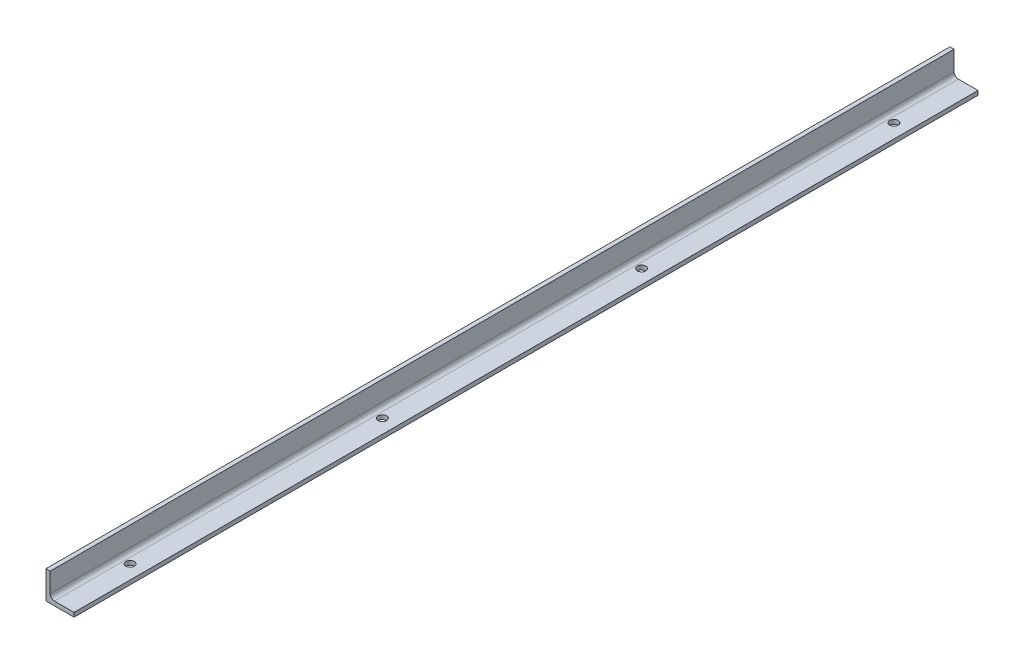
from build123d import *

# Parameters (mm, degrees)
BOSS_EXTRU_1_DEPTH      = 645
ESQUISSE2_R             = 3
ENL_V_MAT_EXTRU_1_DEPTH = 955


with BuildPart() as part:
    # Esquisse1 → Boss.-Extru.1 (new body)
    with BuildSketch(Plane.XY):
        with BuildLine():
            Line((0, 0), (0, 20))
            Line((0, 20), (3, 20))
            Line((3, 20), (3, 6))
            ThreePointArc((3, 6), (3.878679656, 3.878679656), (6, 3))
            Line((6, 3), (20, 3))
            Line((20, 3), (20, 0))
            Line((20, 0), (0, 0))
        make_face()
    extrude(amount=BOSS_EXTRU_1_DEPTH)

    # Esquisse2 → Enlèv. mat.-Extru.1 (cut)
    with BuildSketch(Plane(origin=(0, 0, 0), x_dir=(-1, 0, 0), z_dir=(0, -1, 0))):
        with Locations((-10, -50)):
            Circle(ESQUISSE2_R)
        with Locations((-10, -595)):
            Circle(ESQUISSE2_R)
        with Locations((-10, -230)):
            Circle(ESQUISSE2_R)
        with Locations((-10, -415)):
            Circle(ESQUISSE2_R)
    extrude(amount=-ENL_V_MAT_EXTRU_1_DEPTH, mode=Mode.SUBTRACT)


solid = part.part
